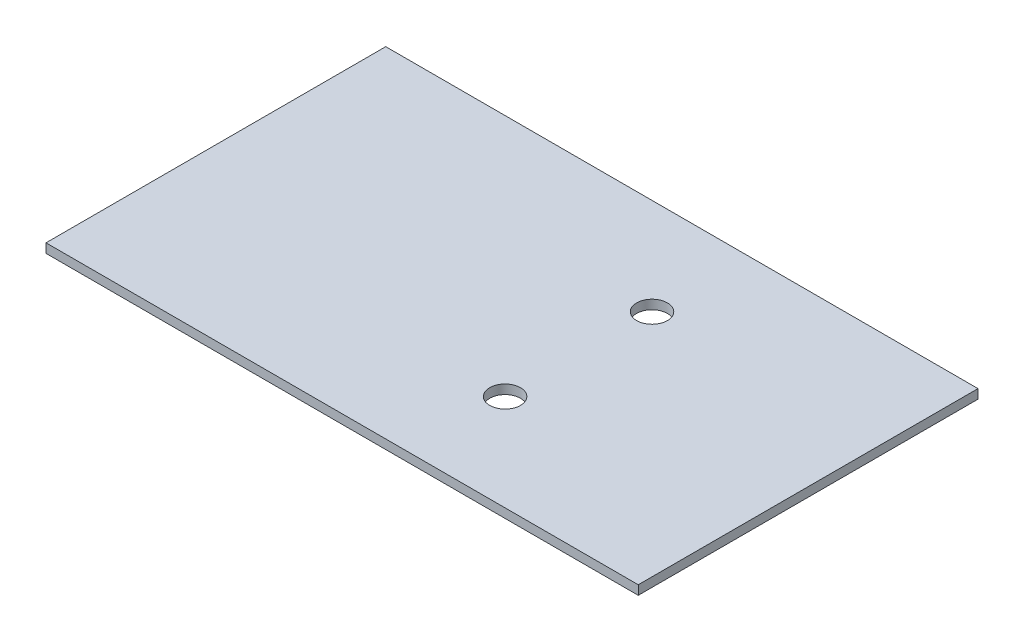
from build123d import *

# Parameters (mm, degrees)
SKETCH1_W           = 129
SKETCH1_H           = 74
BOSS_EXTRUDE1_DEPTH = 2
SKETCH2_R           = 3.35
CUT_EXTRUDE1_DEPTH  = 149.731301346


with BuildPart() as part:
    # Sketch1 → Boss-Extrude1 (new body)
    with BuildSketch(Plane(origin=(0, 0, 0), x_dir=(1, 0, 0), z_dir=(0, 1, 0))):
        with Locations((64.5, -37)):
            Rectangle(SKETCH1_W, SKETCH1_H)
    extrude(amount=BOSS_EXTRUDE1_DEPTH)

    # Sketch2 → Cut-Extrude1 (cut, through all)
    with BuildSketch(Plane.XZ):
        with Locations((79, 21)):
            Circle(SKETCH2_R)
        with Locations((79, 53)):
            Circle(SKETCH2_R)
    extrude(amount=-CUT_EXTRUDE1_DEPTH, mode=Mode.SUBTRACT)


solid = part.part
